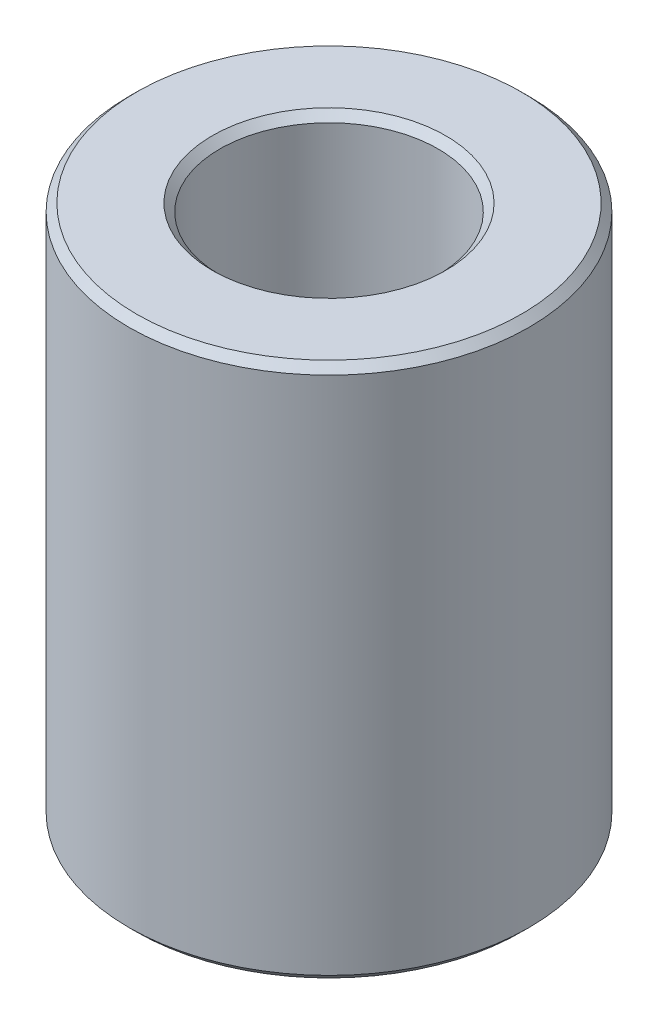
from build123d import *

# Parameters (mm, degrees)
SKETCH1_R           = 15
BOSS_EXTRUDE1_DEPTH = 40.119477797
SKETCH2_R           = 8.182842983
CUT_EXTRUDE1_DEPTH  = 46.382513138
CHAMFER1_SIZE       = 0.570743716


with BuildPart() as part:
    # Sketch1 → Boss-Extrude1 (new body)
    with BuildSketch(Plane(origin=(0, 0, 0), x_dir=(1, 0, 0), z_dir=(0, 1, 0))):
        Circle(SKETCH1_R)
    extrude(amount=BOSS_EXTRUDE1_DEPTH)

    # Sketch2 → Cut-Extrude1 (cut, through all)
    with BuildSketch(Plane(origin=(0, 0, 0), x_dir=(1, 0, 0), z_dir=(0, 1, 0))):
        Circle(SKETCH2_R)
    extrude(amount=CUT_EXTRUDE1_DEPTH, mode=Mode.SUBTRACT)

    # Chamfer1
    chamfer1_edges = [part.edges().sort_by_distance(p)[0] for p in [
        (-8.182842983, 40.119477797, 0),
        (-8.182842983, 0, 0),
        (-15, 0, 0),
        (-15, 40.119477797, 0),
    ]]
    chamfer(chamfer1_edges, length=CHAMFER1_SIZE)


solid = part.part
